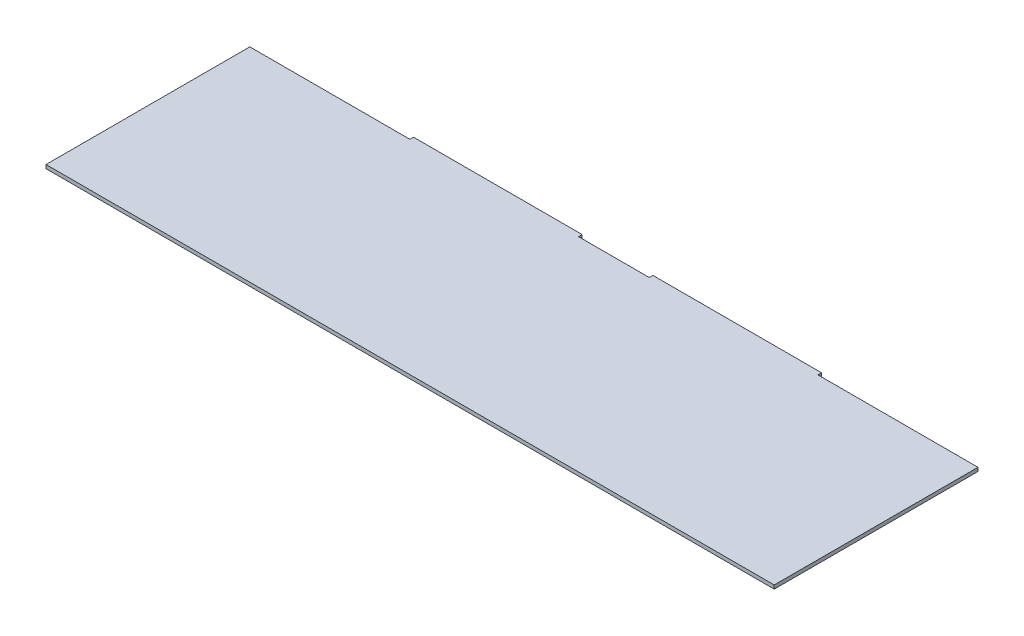
from build123d import *

# Parameters (mm, degrees)
SKETCH1_W           = 635.3556
SKETCH1_H           = 177.8
BOSS_EXTRUDE1_DEPTH = 1.5875
SKETCH2_W           = 147.1549
SKETCH2_H           = 3.175
BOSS_EXTRUDE2_DEPTH = 3.175


with BuildPart() as part:
    # Sketch1 → Boss-Extrude1 (new, symmetric)
    with BuildSketch(Plane(origin=(0, 0, 0), x_dir=(1, 0, 0), z_dir=(0, 1, 0))):
        Rectangle(SKETCH1_W, SKETCH1_H)
    extrude(amount=BOSS_EXTRUDE1_DEPTH, both=True)

    # Sketch2 → Boss-Extrude2 (add)
    with BuildSketch(Plane(origin=(0, 0, -88.9), x_dir=(-1, 0, 0), z_dir=(0, 0, -1))):
        with Locations((104.40035, 0)):
            Rectangle(SKETCH2_W, SKETCH2_H)
        with Locations((-104.40035, 0)):
            Rectangle(SKETCH2_W, SKETCH2_H)
    extrude(amount=BOSS_EXTRUDE2_DEPTH)


solid = part.part
